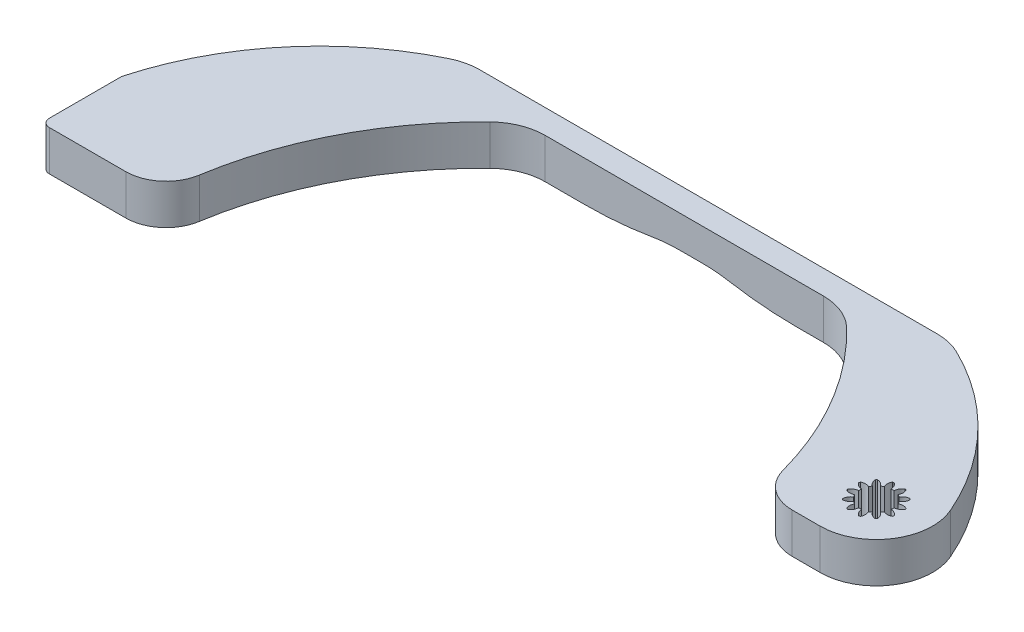
from build123d import *

# Parameters (mm, degrees)
BOSS_EXTRUDE1_DEPTH = 12.7
SKETCH3_R           = 2.286
CUT_EXTRUDE1_DEPTH  = 232.948038146
CAVITY1_START       = -1
CAVITY1_OUTLINE_R   = 2.286
CAVITY1_DEPTH       = 15
CUT_EXTRUDE2_DEPTH  = 232.948038146
FILLET1_R           = 12.7
FILLET2_R           = 2.54
FILLET3_R           = 20.32
FILLET4_R           = 17.78
SKETCH5_W           = 16.51
SKETCH5_H           = 5.08
CUT_EXTRUDE3_DEPTH  = 230.304470216
FILLET5_R           = 127
FILLET6_R           = 50.8


with BuildPart() as part:
    # Sketch1 → Boss-Extrude1 (new body)
    with BuildSketch(Plane(origin=(0, 0, 0), x_dir=(1, 0, 0), z_dir=(0, 1, 0))):
        with BuildLine():
            Line((0, 0), (38.1, 0))
            Line((38.1, 0), (38.1, 25.4))
            ThreePointArc((38.1, 25.4), (19.393233119, 60.430202712), (-12.7, 83.82))
            Line((-12.7, 83.82), (-165.1, 83.82))
            ThreePointArc((-165.1, 83.82), (-197.193233119, 60.430202712), (-215.9, 25.4))
            Line((-215.9, 25.4), (-215.9, 0))
            Line((-215.9, 0), (-177.8, 0))
            ThreePointArc((-177.8, 0), (-166.58502935, 42.017514675), (-139.7, 76.2))
            Line((-139.7, 76.2), (-38.1, 76.2))
            ThreePointArc((-38.1, 76.2), (-11.21497065, 42.017514675), (0, 0))
        make_face()
    extrude(amount=BOSS_EXTRUDE1_DEPTH)

    # Sketch3 → Cut-Extrude1 (cut, through all)
    with BuildSketch(Plane(origin=(0, 12.7, 0), x_dir=(1, 0, 0), z_dir=(0, 1, 0))):
        with Locations(Location((19.05, 28.956, 0), (0, 0, 270))):
            Circle(SKETCH3_R)
    extrude(amount=-CUT_EXTRUDE1_DEPTH, mode=Mode.SUBTRACT)

    # Cavity1: read off the stored shape, not the designer's step
    # Cavity1 outline → Cavity1 (cut)
    with BuildSketch(Plane(origin=(0, 0, 0), x_dir=(1, 0, 0), z_dir=(0, 1, 0)).offset(CAVITY1_START)):
        with BuildLine():
            ThreePointArc((13.557199982, 23.797473427), (13.721594677, 23.627834729), (13.891225968, 23.463432392))
            ThreePointArc((13.891225968, 23.463432392), (15.144839416, 23.828362371), (16.075009031, 24.744607454))
            ThreePointArc((16.075009031, 24.744607454), (16.471799412, 24.490657889), (16.890111616, 24.273983275))
            ThreePointArc((16.890111616, 24.273983275), (16.561647975, 23.010325013), (16.872358933, 21.742184932))
            ThreePointArc((16.872358933, 21.742184932), (17.099548264, 21.677470858), (17.32865444, 21.619909903))
            ThreePointArc((17.32865444, 21.619909903), (18.231850543, 22.56275526), (18.579278518, 23.821331586))
            ThreePointArc((18.579278518, 23.821331586), (19.049883851, 23.799800001), (19.520490153, 23.821310384))
            ThreePointArc((19.520490153, 23.821310384), (19.867861426, 22.562718407), (20.77101505, 21.61983236))
            ThreePointArc((20.77101505, 21.61983236), (21.000123819, 21.677382993), (21.227316065, 21.742086832))
            ThreePointArc((21.227316065, 21.742086832), (21.538084156, 23.010212914), (21.209677446, 24.273885972))
            ThreePointArc((21.209677446, 24.273885972), (21.627999411, 24.490541739), (22.024801233, 24.744473428))
            ThreePointArc((22.024801233, 24.744473428), (22.954929568, 23.828186439), (24.208526573, 23.463199982))
            ThreePointArc((24.208526573, 23.463199982), (24.378165271, 23.627594677), (24.542567608, 23.797225968))
            ThreePointArc((24.542567608, 23.797225968), (24.177637629, 25.050839416), (23.261392546, 25.981009031))
            ThreePointArc((23.261392546, 25.981009031), (23.515342111, 26.377799412), (23.732016725, 26.796111616))
            ThreePointArc((23.732016725, 26.796111616), (24.995674987, 26.467647975), (26.263815068, 26.778358933))
            ThreePointArc((26.263815068, 26.778358933), (26.328529142, 27.005548264), (26.386090097, 27.23465444))
            ThreePointArc((26.386090097, 27.23465444), (25.44324474, 28.137850543), (24.184668414, 28.485278518))
            ThreePointArc((24.184668414, 28.485278518), (24.206199999, 28.955883851), (24.184689616, 29.426490153))
            ThreePointArc((24.184689616, 29.426490153), (25.443281593, 29.773861426), (26.38616764, 30.67701505))
            ThreePointArc((26.38616764, 30.67701505), (26.328617007, 30.906123819), (26.263913168, 31.133316065))
            ThreePointArc((26.263913168, 31.133316065), (24.995787086, 31.444084156), (23.732114028, 31.115677446))
            ThreePointArc((23.732114028, 31.115677446), (23.515458261, 31.533999411), (23.261526572, 31.930801233))
            ThreePointArc((23.261526572, 31.930801233), (24.177813561, 32.860929568), (24.542800018, 34.114526573))
            ThreePointArc((24.542800018, 34.114526573), (24.378405323, 34.284165271), (24.208774032, 34.448567608))
            ThreePointArc((24.208774032, 34.448567608), (22.955160584, 34.083637629), (22.024990969, 33.167392546))
            ThreePointArc((22.024990969, 33.167392546), (21.628200588, 33.421342111), (21.209888384, 33.638016725))
            ThreePointArc((21.209888384, 33.638016725), (21.538352025, 34.901674987), (21.227641067, 36.169815068))
            ThreePointArc((21.227641067, 36.169815068), (21.000451736, 36.234529142), (20.77134556, 36.292090097))
            ThreePointArc((20.77134556, 36.292090097), (19.868149457, 35.34924474), (19.520721482, 34.090668414))
            ThreePointArc((19.520721482, 34.090668414), (19.050116149, 34.112199999), (18.579509847, 34.090689616))
            ThreePointArc((18.579509847, 34.090689616), (18.232138574, 35.349281593), (17.32898495, 36.29216764))
            ThreePointArc((17.32898495, 36.29216764), (17.099876181, 36.234617007), (16.872683935, 36.169913168))
            ThreePointArc((16.872683935, 36.169913168), (16.561915844, 34.901787086), (16.890322554, 33.638114028))
            ThreePointArc((16.890322554, 33.638114028), (16.472000589, 33.421458261), (16.075198767, 33.167526572))
            ThreePointArc((16.075198767, 33.167526572), (15.145070432, 34.083813561), (13.891473427, 34.448800018))
            ThreePointArc((13.891473427, 34.448800018), (13.721834729, 34.284405323), (13.557432392, 34.114774032))
            ThreePointArc((13.557432392, 34.114774032), (13.922362371, 32.861160584), (14.838607454, 31.930990969))
            ThreePointArc((14.838607454, 31.930990969), (14.584657889, 31.534200588), (14.367983275, 31.115888384))
            ThreePointArc((14.367983275, 31.115888384), (13.104325013, 31.444352025), (11.836184932, 31.133641067))
            ThreePointArc((11.836184932, 31.133641067), (11.771470858, 30.906451736), (11.713909903, 30.67734556))
            ThreePointArc((11.713909903, 30.67734556), (12.65675526, 29.774149457), (13.915331586, 29.426721482))
            ThreePointArc((13.915331586, 29.426721482), (13.893800001, 28.956116149), (13.915310384, 28.485509847))
            ThreePointArc((13.915310384, 28.485509847), (12.656718407, 28.138138574), (11.71383236, 27.23498495))
            ThreePointArc((11.71383236, 27.23498495), (11.771382993, 27.005876181), (11.836086832, 26.778683935))
            ThreePointArc((11.836086832, 26.778683935), (13.104212914, 26.467915844), (14.367885972, 26.796322554))
            ThreePointArc((14.367885972, 26.796322554), (14.584541739, 26.378000589), (14.838473428, 25.981198767))
            ThreePointArc((14.838473428, 25.981198767), (13.922186439, 25.051070432), (13.557199982, 23.797473427))
        make_face()
        with Locations((19.05, 28.956)):
            Circle(CAVITY1_OUTLINE_R, mode=Mode.SUBTRACT)
    extrude(amount=CAVITY1_DEPTH, mode=Mode.SUBTRACT)

    # Sketch4 → Cut-Extrude2 (cut, through all)
    with BuildSketch(Plane(origin=(0, 12.7, 0), x_dir=(1, 0, 0), z_dir=(0, 1, 0))):
        with BuildLine():
            Line((38.1, 12.7), (-1.496322316, 12.7))
            ThreePointArc((-1.496322316, 12.7), (-0.559939387, 6.372176412), (0, 0))
            Line((0, 0), (38.1, 0))
            Line((38.1, 0), (38.1, 12.7))
        make_face()
    extrude(amount=-CUT_EXTRUDE2_DEPTH, mode=Mode.SUBTRACT)

    # Fillet1
    fillet1_edges = [part.edges().sort_by_distance(p)[0] for p in [
        (-1.496322316, 6.35, -12.7),
        (-177.8, 6.35, 0),
    ]]
    fillet(fillet1_edges, radius=FILLET1_R)

    # Fillet2
    fillet2_edges = [part.edges().sort_by_distance(p)[0] for p in [
        (-215.9, 6.35, 0),
    ]]
    fillet(fillet2_edges, radius=FILLET2_R)

    # Fillet3
    # the kernel refuses this fillet: 20.32 mm, written as the material it takes off along each edge
    with BuildSketch(Plane(origin=(38.1, 59.792860393, -12.7), x_dir=(0, 0, -1), z_dir=(0, -1, 0))) as fillet3_piece_1:
        with BuildLine():
            CenterArc((20.32, -18.837144157), FILLET3_R, 112.024312837, 67.975687163)
            Line((0, -18.837144157), (-0.4064, -18.837144157))
            Line((-0.4064, -18.837144157), (-0.4064, 0))
            Line((-0.4064, 0), (0, 0.4064))
            ThreePointArc((0, 0.4064), (6.35, 0.4064), (12.5476, 0.376742883))
            Line((12.5476, 0.376742883), (12.7, 0))
        make_face()
    extrude(amount=106.885720786, mode=Mode.SUBTRACT)

    # Fillet4
    fillet4_edges = [part.edges().sort_by_distance(p)[0] for p in [
        (38.1, 6.35, -25.4),
        (-139.7, 6.35, -76.2),
        (-38.1, 6.35, -76.2),
        (-12.7, 6.35, -83.82),
        (-165.1, 6.35, -83.82),
    ]]
    fillet(fillet4_edges, radius=FILLET4_R)

    # Sketch5 → Cut-Extrude3 (cut, through all)
    with BuildSketch(Plane.XY.offset(-76.2)):
        with Locations((-86.868, 0)):
            Rectangle(SKETCH5_W, SKETCH5_H)
    extrude(amount=-CUT_EXTRUDE3_DEPTH, mode=Mode.SUBTRACT)

    # Fillet5
    # the kernel refuses this fillet: 127 mm, written as the material it takes off along each edge
    with BuildSketch(Plane(origin=(-95.123, 0, -13.018297744), x_dir=(-1, 0, 0), z_dir=(0, 0, -1)), Plane(origin=(-78.613, 0, -147.001702256), x_dir=(1, 0, 0), z_dir=(0, 0, 1))) as fillet5_piece_1:
        with BuildLine():
            CenterArc((25.272680903, 127), FILLET5_R, 258.521659045, 11.478340955)
            Line((0, 2.54), (0, 0))
            Line((0, 0), (25.272680903, 0))
        make_face()
    extrude(amount=133.983404513, mode=Mode.SUBTRACT)

    # Fillet6
    fillet6_edges = [part.edges().sort_by_distance(p)[0] for p in [
        (-78.613, 2.54, -80.01),
        (-95.123, 2.54, -80.01),
    ]]
    fillet(fillet6_edges, radius=FILLET6_R)


solid = part.part
